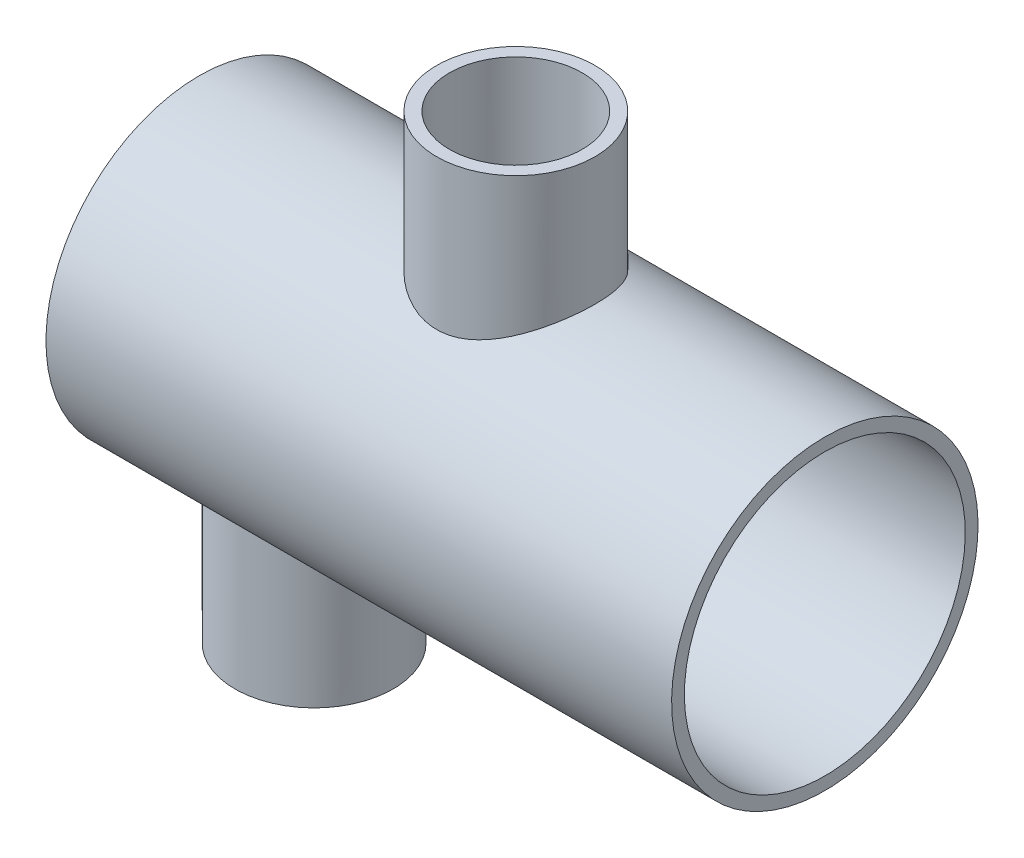
from build123d import *

# Parameters (mm, degrees)
SCHIZZO1_W                            = 49
SCHIZZO1_H                            = 1
ESTRUSIONE_SOTTILE1_REACH             = 57.866
ESTRUSIONE_SOTTILE1_END_RADIUS        = 12
SCHIZZO2_R                            = 6.2
SCHIZZO2_R_2                          = 5.2
ESTRUSIONE_SOTTILE1_DIRECTION_2_DEPTH = 10
ESTRUSIONE_SOTTILE2_REACH             = 62.836
ESTRUSIONE_SOTTILE2_END_RADIUS        = 12
SCHIZZO3_R                            = 6.2
SCHIZZO3_R_2                          = 5.2
ESTRUSIONE_SOTTILE2_DIRECTION_2_DEPTH = 10
SCHIZZO4_R                            = 5.2
TAGLIO_ESTRUSIONE2_DEPTH              = 15
SCHIZZO5_R                            = 5.2
TAGLIO_ESTRUSIONE3_DEPTH              = 15
SCHIZZO6_W                            = 1
SCHIZZO6_H                            = 1
RACCORDO1_R                           = 1


with BuildPart() as part:
    # Schizzo1 → Rivoluzione-Sottile2 (revolve)
    with BuildSketch(Plane.XY):
        with Locations((24.5, 11.5)):
            Rectangle(SCHIZZO1_W, SCHIZZO1_H)
    revolve(axis=Axis((49, 0, 0), (-1, 0, 0)))

    # Estrusione-Sottile1: up to this cylinder (the profile starts outside it)
    estrusione_sottile1_end = Plane(origin=(15.024638, 0, 0), z_dir=(1, 0, 0)) * Cylinder(ESTRUSIONE_SOTTILE1_END_RADIUS, 140.732, mode=Mode.PRIVATE)
    # Schizzo2 → Estrusione-Sottile1 (add, up to the surface)
    with BuildSketch(Plane(origin=(0, -12, 0), x_dir=(-1, 0, 0), z_dir=(0, -1, 0)), mode=Mode.PRIVATE) as estrusione_sottile1_sk1:
        with Locations((-9, 0)):
            Circle(SCHIZZO2_R)
        with Locations((-9, 0)):
            Circle(SCHIZZO2_R_2, mode=Mode.SUBTRACT)
    estrusione_sottile1_tool1 = extrude(estrusione_sottile1_sk1.sketch, amount=-ESTRUSIONE_SOTTILE1_REACH, mode=Mode.PRIVATE) - estrusione_sottile1_end
    add(estrusione_sottile1_tool1.solids().sort_by_distance((15.024638, -12, 0))[0])
    add(estrusione_sottile1_tool1.solids().sort_by_distance((15.024638, -12, 0))[1])

    # Schizzo2 → Estrusione-Sottile1 direction 2 (add)
    with BuildSketch(Plane(origin=(0, -12, 0), x_dir=(-1, 0, 0), z_dir=(0, -1, 0))):
        with Locations((-9, 0)):
            Circle(SCHIZZO2_R)
        with Locations((-9, 0)):
            Circle(SCHIZZO2_R_2, mode=Mode.SUBTRACT)
    extrude(amount=ESTRUSIONE_SOTTILE1_DIRECTION_2_DEPTH)

    # Estrusione-Sottile2: up to this cylinder (the profile starts outside it)
    estrusione_sottile2_end = Plane(origin=(18.775362, 0, 0), z_dir=(1, 0, 0)) * Cylinder(ESTRUSIONE_SOTTILE2_END_RADIUS, 150.672, mode=Mode.PRIVATE)
    # Schizzo3 → Estrusione-Sottile2 (add, up to the surface)
    with BuildSketch(Plane(origin=(0, 12, 0), x_dir=(1, 0, 0), z_dir=(0, 1, 0)), mode=Mode.PRIVATE) as estrusione_sottile2_sk1:
        with Locations((24.8, 0)):
            Circle(SCHIZZO3_R)
        with Locations((24.8, 0)):
            Circle(SCHIZZO3_R_2, mode=Mode.SUBTRACT)
    estrusione_sottile2_tool1 = extrude(estrusione_sottile2_sk1.sketch, amount=-ESTRUSIONE_SOTTILE2_REACH, mode=Mode.PRIVATE) - estrusione_sottile2_end
    add(estrusione_sottile2_tool1.solids().sort_by_distance((18.775362, 12, 0))[0])
    add(estrusione_sottile2_tool1.solids().sort_by_distance((18.775362, 12, 0))[1])

    # Schizzo3 → Estrusione-Sottile2 direction 2 (add)
    with BuildSketch(Plane(origin=(0, 12, 0), x_dir=(1, 0, 0), z_dir=(0, 1, 0))):
        with Locations((24.8, 0)):
            Circle(SCHIZZO3_R)
        with Locations((24.8, 0)):
            Circle(SCHIZZO3_R_2, mode=Mode.SUBTRACT)
    extrude(amount=ESTRUSIONE_SOTTILE2_DIRECTION_2_DEPTH)

    # Schizzo4 → Taglio-Estrusione2 (cut)
    with BuildSketch(Plane.XZ.offset(22)):
        with Locations((9, 0)):
            Circle(SCHIZZO4_R)
    extrude(amount=-TAGLIO_ESTRUSIONE2_DEPTH, mode=Mode.SUBTRACT)

    # Schizzo5 → Taglio-Estrusione3 (cut)
    with BuildSketch(Plane(origin=(0, 22, 0), x_dir=(1, 0, 0), z_dir=(0, 1, 0))):
        with Locations(Location((24.8, 0, 0), (0, 0, 180))):
            Circle(SCHIZZO5_R)
    extrude(amount=-TAGLIO_ESTRUSIONE3_DEPTH, mode=Mode.SUBTRACT)

    # Schizzo6 → Rivoluzione1 (revolve)
    with BuildSketch(Plane.XY):
        with Locations((14.7, 10.5)):
            Rectangle(SCHIZZO6_W, SCHIZZO6_H)
    revolve(axis=Axis((0, 0, 0), (1, 0, 0)))

    # Raccordo1
    raccordo1_edges = [part.edges().sort_by_distance(p)[0] for p in [
        (15.2, -11, 0),
    ]]
    fillet(raccordo1_edges, radius=RACCORDO1_R - 0.0001)  # a hair under: the kernel refuses the full size


solid = part.part
